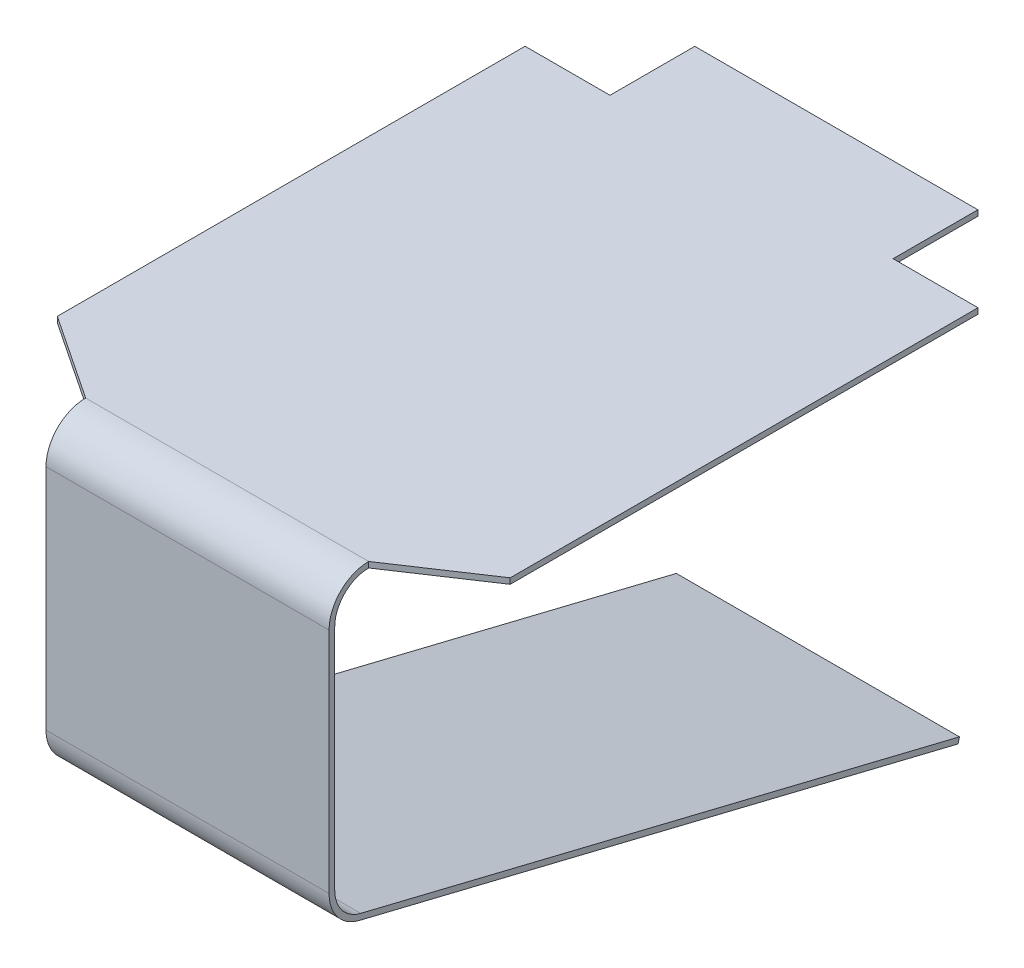
from build123d import *

# Parameters (mm, degrees)
EXTRUDE_1_DEPTH      = 1.25
EXTRUDE_1_DEPTH_BACK = 1.25
SKETCH_2_W           = 4.631165465
SKETCH_2_H           = 0.05
EXTRUDE_1_2_DEPTH    = 0.75
CHAMFER_1_SIZE2      = 0.5
CHAMFER_1_SIZE       = 0.75
CHAMFER_2_SIZE2      = 0.5
CHAMFER_2_SIZE       = 0.75


with BuildPart() as part:
    # Эскиз1 → Extrude 1 (new, two sides: drawn at the far end of the back side and taken through both)
    with BuildSketch(Plane(origin=(0, 0, 0), x_dir=(0, 0, -1), z_dir=(1, 0, 0)).offset(-EXTRUDE_1_DEPTH_BACK)):
        with BuildLine():
            Line((0, 0), (-5.38, 0))
            ThreePointArc((-5.38, 0), (-5.592132034, -0.087867966), (-5.68, -0.3))
            Line((-5.68, -0.3), (-5.68, -2.314556047))
            ThreePointArc((-5.68, -2.314556047), (-5.615998777, -2.499770997), (-5.451302817, -2.60595939))
            Line((-5.451302817, -2.60595939), (-0.162763373, -3.9))
            Line((-0.162763373, -3.9), (-0.174647176, -3.948567224))
            Line((-0.174647176, -3.948567224), (-5.46318662, -2.654526614))
            ThreePointArc((-5.46318662, -2.654526614), (-5.655331906, -2.530640155), (-5.73, -2.314556047))
            Line((-5.73, -2.314556047), (-5.73, -0.3))
            ThreePointArc((-5.73, -0.3), (-5.627487373, -0.052512627), (-5.38, 0.05))
            Line((-5.38, 0.05), (0, 0.05))
            Line((0, 0.05), (0, 0))
        make_face()
    extrude(amount=EXTRUDE_1_DEPTH + EXTRUDE_1_DEPTH_BACK)

    # Эскиз2 → Extrude 1 2 (add)
    with BuildSketch(Plane(origin=(1.25, 0, 0), x_dir=(0, 0, -1), z_dir=(1, 0, 0))):
        with Locations((-3.064417268, 0.025)):
            Rectangle(SKETCH_2_W, SKETCH_2_H)
    extrude_1_2 = extrude(amount=EXTRUDE_1_2_DEPTH)

    # Фаска1
    chamfer_1_edges = [part.edges().sort_by_distance(p)[0] for p in [
        (2, 0.025, 5.38),
    ]]
    chamfer_1_side = [part.faces().sort_by_distance(p)[0] for p in [
        (1.99, 0.025, 5.38),
    ]]
    chamfer(chamfer_1_edges, length=CHAMFER_1_SIZE - 0.0001, length2=CHAMFER_1_SIZE2 - 0.0001, reference=chamfer_1_side[0])  # a hair under: the kernel refuses the full size

    # Зеркальное отражение1: Extrude 1 2 across plane
    add(extrude_1_2.mirror(Plane(origin=(0, 0, 0), x_dir=(0, 0, 1), z_dir=(1, 0, 0))))

    # Фаска2
    chamfer_2_edges = [part.edges().sort_by_distance(p)[0] for p in [
        (-2, 0.025, 5.38),
    ]]
    chamfer_2_side = [part.faces().sort_by_distance(p)[0] for p in [
        (-1.99, 0.025, 5.38),
    ]]
    chamfer(chamfer_2_edges, length=CHAMFER_2_SIZE - 0.0001, length2=CHAMFER_2_SIZE2 - 0.0001, reference=chamfer_2_side[0])  # a hair under: the kernel refuses the full size


solid = part.part
